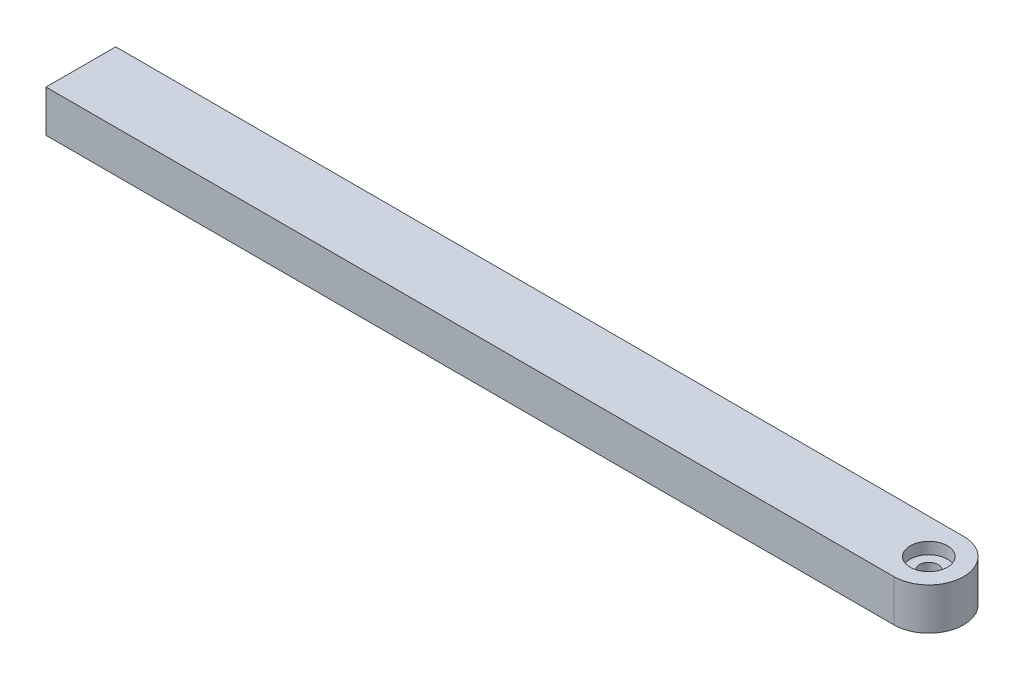
from build123d import *

# Parameters (mm, degrees)
SKETCH1_R           = 4
BOSS_EXTRUDE1_DEPTH = 18
SKETCH2_R           = 8
CUT_EXTRUDE1_DEPTH  = 5


with BuildPart() as part:
    # Sketch1 → Boss-Extrude1 (new body)
    with BuildSketch(Plane(origin=(0, 0, 0), x_dir=(1, 0, 0), z_dir=(0, 1, 0))):
        with BuildLine():
            Line((-187.145158429, 15), (-187.145158429, -15))
            Line((-187.145158429, -15), (177.854841571, -15))
            ThreePointArc((177.854841571, -15), (192.854841571, 0), (177.854841571, 15))
            Line((177.854841571, 15), (-187.145158429, 15))
        make_face()
        with Locations((177.854841571, 0)):
            Circle(SKETCH1_R, mode=Mode.SUBTRACT)
    extrude(amount=BOSS_EXTRUDE1_DEPTH)

    # Sketch2 → Cut-Extrude1 (cut)
    with BuildSketch(Plane(origin=(0, 18, 0), x_dir=(1, 0, 0), z_dir=(0, 1, 0))):
        with Locations((177.854841571, 0)):
            Circle(SKETCH2_R)
    extrude(amount=-CUT_EXTRUDE1_DEPTH, mode=Mode.SUBTRACT)


solid = part.part
